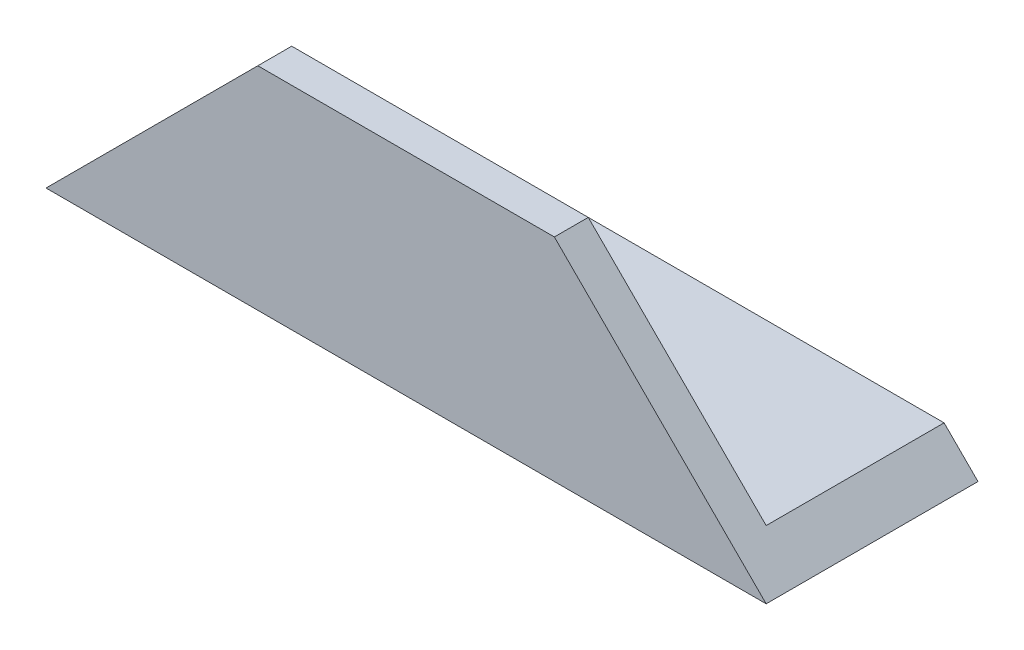
from build123d import *

# Parameters (mm, degrees)
EXTRUDE_1_DEPTH     = 85
CUT_EXTRUDE_1_DEPTH = 93.059763198
SKETCH_3_W          = 32
SKETCH_3_H          = 21
CUT_EXTRUDE_2_DEPTH = 10


with BuildPart() as part:
    # Эскиз1 → Вытянуть-Тонкостенный1 (new body)
    with BuildSketch(Plane(origin=(0, 0, 0), x_dir=(0, 0, -1), z_dir=(1, 0, 0))):
        Polygon((0, 25), (0, 0), (25, 0), (25, 4), (4, 4), (4, 25), align=None)
    extrude(amount=EXTRUDE_1_DEPTH)

    # Эскиз2 → Вырез-Вытянуть1 (cut, through all)
    with BuildSketch(Plane.XY):
        Polygon((0, 0), (0, 25), (25, 25), align=None)
        Polygon((60, 25), (85, 25), (85, 0), align=None)
    extrude(amount=-CUT_EXTRUDE_1_DEPTH, mode=Mode.SUBTRACT)

    # Эскиз3 → Вырез-Вытянуть2 (cut)
    with BuildSketch(Plane.XZ):
        with Locations((16, -14.5)):
            Rectangle(SKETCH_3_W, SKETCH_3_H)
    extrude(amount=-CUT_EXTRUDE_2_DEPTH, mode=Mode.SUBTRACT)


solid = part.part
